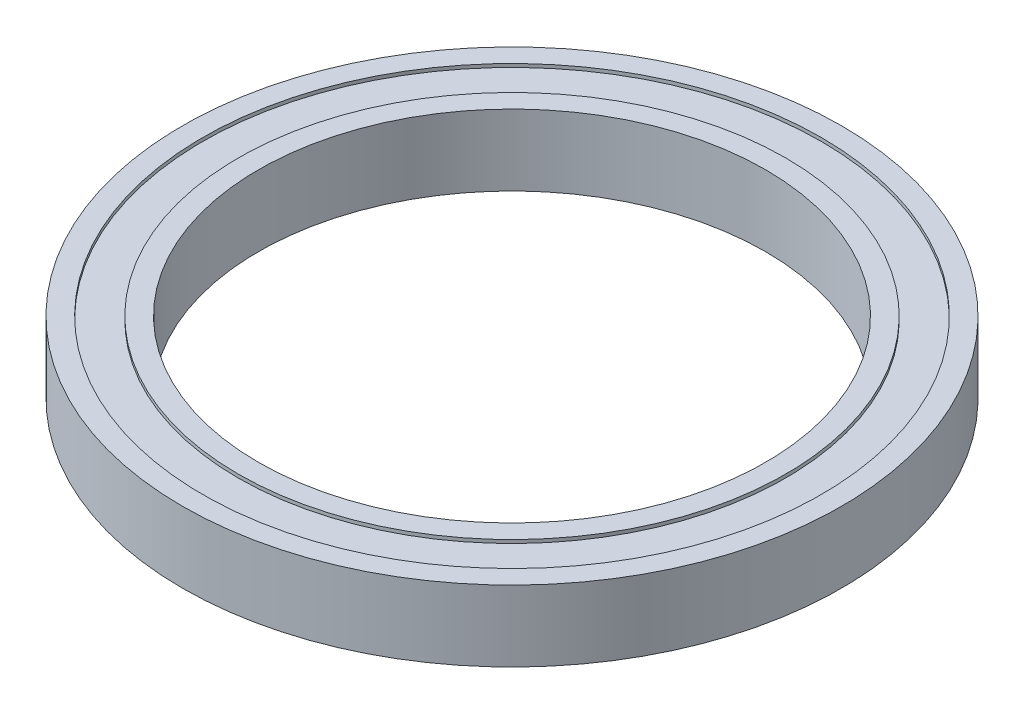
from build123d import *


with BuildPart() as part:
    # Sketch1 → Revolve1 (revolve)
    with BuildSketch(Plane.XY):
        Polygon((25, 0), (27, 0), (27, 0.338784593), (30.5, 0.338784593), (30.5, 0), (32.5, 0), (32.5, 7), (30.5, 7), (30.5, 6.661215407), (27, 6.661215407), (27, 7), (25, 7), align=None)
    revolve(axis=Axis((0, 0, 0), (0, 1, 0)))


solid = part.part
